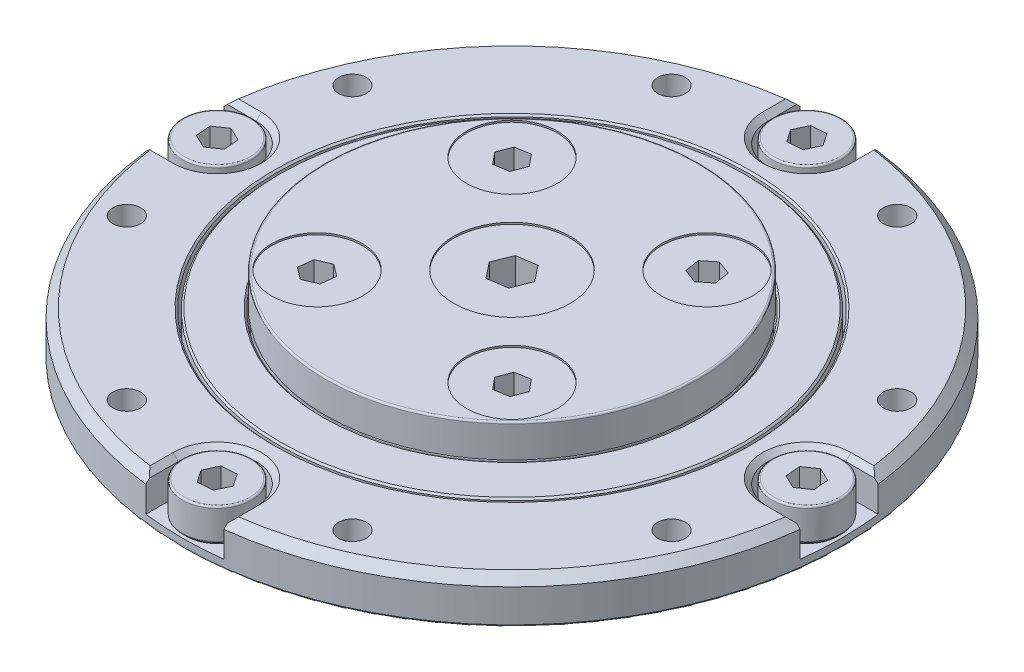
from build123d import *

# Parameters (mm, degrees)
SKETCH1_R                    = 19
BOSS_EXTRUDE1_DEPTH          = 2.5
CHAMFER1_SIZE                = 0.5
CUT_EXTRUDE1_DEPTH           = 2
CHAMFER2_SIZE                = 0.3
SKETCH3_R                    = 1.8
BOSS_EXTRUDE2_DEPTH          = 0.4
SKETCH4_R                    = 2
BOSS_EXTRUDE3_DEPTH          = 1.6
CHAMFER3_SIZE                = 0.4
FILLET1_R                    = 0.1
CUT_EXTRUDE2_DEPTH           = 1.5
CIRPATTERN1_COUNT            = 4
CHAMFER2_OF_CIRPATTERN1_SIZE = 0.3
CHAMFER3_OF_CIRPATTERN1_SIZE = 0.4
FILLET1_OF_CIRPATTERN1_R     = 0.1
CUT_EXTRUDE3_DEPTH           = 27.986107678
CUT_EXTRUDE3_DEPTH_BACK      = 27.986107678
SKETCH6_R                    = 0.5
M2_TAPPED_HOLE1_D            = 1.6
CIRPATTERN2_COUNT            = 8
SKETCH9_R                    = 13.639669348
SKETCH9_R_2                  = 13.482003981
CUT_EXTRUDE4_DEPTH           = 2.49
CHAMFER4_SIZE                = 0.1
SKETCH11_R                   = 10.823295538
SKETCH11_R_2                 = 10.667622933
CUT_EXTRUDE5_DEPTH           = 2.49
CHAMFER5_SIZE                = 0.1
SKETCH12_R                   = 10.75
BOSS_EXTRUDE4_DEPTH          = 1.9
FILLET2_R                    = 0.1
SKETCH13_R                   = 3.357648563
SKETCH13_R_2                 = 2.616913992
CUT_EXTRUDE6_DEPTH           = 0.1
CUT_EXTRUDE7_DEPTH           = 1.5
CUT_EXTRUDE8_DEPTH           = 2
FILLET3_R                    = 0.1


with BuildPart() as part:
    # Sketch1 → Boss-Extrude1 (new body)
    with BuildSketch(Plane(origin=(0, 0, 0), x_dir=(1, 0, 0), z_dir=(0, 1, 0))):
        with Locations(Location((0, 0, 0), (0, 0, 270))):
            Circle(SKETCH1_R)
    extrude(amount=BOSS_EXTRUDE1_DEPTH)

    # Chamfer1
    chamfer1_edges = [part.edges().sort_by_distance(p)[0] for p in [
        (0, 2.5, -19),
    ]]
    chamfer(chamfer1_edges, length=CHAMFER1_SIZE)

    # Sketch2 → Cut-Extrude1 (cut)
    with BuildSketch(Plane(origin=(0, 2.5, 0), x_dir=(1, 0, 0), z_dir=(0, 1, 0))):
        with BuildLine():
            Line((-2.25, 17), (-2.25, 19.25))
            Line((-2.25, 19.25), (2.25, 19.25))
            Line((2.25, 19.25), (2.25, 17))
            ThreePointArc((2.25, 17), (0, 14.75), (-2.25, 17))
        make_face()
    cut_extrude1 = extrude(amount=-CUT_EXTRUDE1_DEPTH, mode=Mode.SUBTRACT)

    # Chamfer2
    chamfer2_edges = [part.edges().sort_by_distance(p)[0] for p in [
        (2.25, 2.5, -17.681332964),
        (0, 2.5, -14.75),
        (-2.25, 2.5, -17.681332964),
    ]]
    chamfer(chamfer2_edges, length=CHAMFER2_SIZE)

    # Sketch3 → Boss-Extrude2 (add)
    with BuildSketch(Plane(origin=(0, 0.5, 0), x_dir=(1, 0, 0), z_dir=(0, 1, 0))):
        with Locations(Location((0, 17, 0), (0, 0, 270))):
            Circle(SKETCH3_R)
    boss_extrude2 = extrude(amount=BOSS_EXTRUDE2_DEPTH)

    # Sketch4 → Boss-Extrude3 (add)
    with BuildSketch(Plane(origin=(0, 0.9, 0), x_dir=(1, 0, 0), z_dir=(0, 1, 0))):
        with Locations(Location((0, 17, 0), (0, 0, 270))):
            Circle(SKETCH4_R)
    boss_extrude3 = extrude(amount=BOSS_EXTRUDE3_DEPTH)

    # Chamfer3
    # the kernel refuses this chamfer: 0.4 mm, written as the material it adds along each edge
    with BuildSketch(Plane(origin=(0, 0.9, -17), x_dir=(0, 0, 1), z_dir=(-1, 0, 0))) as chamfer3_piece_1_section:
        Polygon((1.8 + CHAMFER3_SIZE, 0), (1.8, -CHAMFER3_SIZE), (1.8, 0), align=None)
    chamfer3_piece_1 = revolve(axis=Axis((0, 0.9, -17), (0, 1, 0)), mode=Mode.PRIVATE)
    chamfer3_piece_1 = chamfer3_piece_1 & Plane(origin=(0, 0.600836468, -17), x_dir=(0, 0, 1), z_dir=(0, -1, 0)) * Cylinder(2, 9, mode=Mode.PRIVATE)
    add(chamfer3_piece_1)

    # Fillet1
    fillet1_edges = [part.edges().sort_by_distance(p)[0] for p in [
        (0, 2.5, -19),
        (0, 0.7, -19),
    ]]
    fillet(fillet1_edges, radius=FILLET1_R)

    # Sketch5 → Cut-Extrude2 (cut)
    with BuildSketch(Plane(origin=(0, 2.5, 0), x_dir=(1, 0, 0), z_dir=(0, 1, 0))):
        Polygon((-0.490661702, 17.713618312), (-0.863342437, 16.931883658), (-0.372680736, 16.218265346), (0.490661702, 16.286381688), (0.863342437, 17.068116342), (0.372680736, 17.781734654), align=None)
    cut_extrude2 = extrude(amount=-CUT_EXTRUDE2_DEPTH, mode=Mode.SUBTRACT)

    # CirPattern1: Cut-Extrude1, Boss-Extrude2, Boss-Extrude3, Cut-Extrude2 ×4 about axis
    cirpattern1_axis = Axis((0, 0, 0), (0, 1, 0))
    add([cut_extrude1.rotate(cirpattern1_axis, i * 360 / CIRPATTERN1_COUNT) for i in range(1, CIRPATTERN1_COUNT)], mode=Mode.SUBTRACT)
    add([boss_extrude2.rotate(cirpattern1_axis, i * 360 / CIRPATTERN1_COUNT) for i in range(1, CIRPATTERN1_COUNT)])
    add([boss_extrude3.rotate(cirpattern1_axis, i * 360 / CIRPATTERN1_COUNT) for i in range(1, CIRPATTERN1_COUNT)])
    add([cut_extrude2.rotate(cirpattern1_axis, i * 360 / CIRPATTERN1_COUNT) for i in range(1, CIRPATTERN1_COUNT)], mode=Mode.SUBTRACT)

    # Chamfer2 of CirPattern1
    chamfer2_of_cirpattern1_edges = [part.edges().sort_by_distance(p)[0] for p in [
        (-17.681332964, 2.5, -2.25),
        (-14.75, 2.5, 0),
        (-17.681332964, 2.5, 2.25),
        (-2.25, 2.5, 17.681332964),
        (0, 2.5, 14.75),
        (2.25, 2.5, 17.681332964),
        (17.681332964, 2.5, 2.25),
        (14.75, 2.5, 0),
        (17.681332964, 2.5, -2.25),
    ]]
    chamfer(chamfer2_of_cirpattern1_edges, length=CHAMFER2_OF_CIRPATTERN1_SIZE)

    # Chamfer3 of CirPattern1
    # the kernel refuses this chamfer: 0.4 mm, written as the material it adds along each edge
    with BuildSketch(Plane(origin=(-17, 0.9, 0), x_dir=(1, 0, 0), z_dir=(0, 0, 1))) as chamfer3_of_cirpattern1_piece_1_section:
        Polygon((1.8, -CHAMFER3_OF_CIRPATTERN1_SIZE), (1.8 + CHAMFER3_OF_CIRPATTERN1_SIZE, 0), (1.8, 0), align=None)
    chamfer3_of_cirpattern1_piece_1 = revolve(axis=Axis((-17, 0.9, 0), (0, 1, 0)), mode=Mode.PRIVATE)
    chamfer3_of_cirpattern1_piece_1 = chamfer3_of_cirpattern1_piece_1 & Plane(origin=(-17, 0.600836468, 0), x_dir=(1, 0, 0), z_dir=(0, -1, 0)) * Cylinder(2, 9, mode=Mode.PRIVATE)
    add(chamfer3_of_cirpattern1_piece_1)
    with BuildSketch(Plane(origin=(0, 0.9, 17), x_dir=(0, 0, -1), z_dir=(1, 0, 0))) as chamfer3_of_cirpattern1_piece_2_section:
        Polygon((1.8, -CHAMFER3_OF_CIRPATTERN1_SIZE), (1.8 + CHAMFER3_OF_CIRPATTERN1_SIZE, 0), (1.8, 0), align=None)
    chamfer3_of_cirpattern1_piece_2 = revolve(axis=Axis((0, 0.9, 17), (0, 1, 0)), mode=Mode.PRIVATE)
    chamfer3_of_cirpattern1_piece_2 = chamfer3_of_cirpattern1_piece_2 & Plane(origin=(0, 0.600836468, 17), x_dir=(0, 0, -1), z_dir=(0, -1, 0)) * Cylinder(2, 9, mode=Mode.PRIVATE)
    add(chamfer3_of_cirpattern1_piece_2)
    with BuildSketch(Plane(origin=(17, 0.9, 0), x_dir=(-1, 0, 0), z_dir=(0, 0, -1))) as chamfer3_of_cirpattern1_piece_3_section:
        Polygon((1.8, -CHAMFER3_OF_CIRPATTERN1_SIZE), (1.8 + CHAMFER3_OF_CIRPATTERN1_SIZE, 0), (1.8, 0), align=None)
    chamfer3_of_cirpattern1_piece_3 = revolve(axis=Axis((17, 0.9, 0), (0, 1, 0)), mode=Mode.PRIVATE)
    chamfer3_of_cirpattern1_piece_3 = chamfer3_of_cirpattern1_piece_3 & Plane(origin=(17, 0.600836468, 0), x_dir=(-1, 0, 0), z_dir=(0, -1, 0)) * Cylinder(2, 9, mode=Mode.PRIVATE)
    add(chamfer3_of_cirpattern1_piece_3)

    # Fillet1 of CirPattern1
    fillet1_of_cirpattern1_edges = [part.edges().sort_by_distance(p)[0] for p in [
        (-19, 2.5, 0),
        (-19, 0.7, 0),
        (0, 2.5, 19),
        (0, 0.7, 19),
        (19, 2.5, 0),
        (19, 0.7, 0),
    ]]
    fillet(fillet1_of_cirpattern1_edges, radius=FILLET1_OF_CIRPATTERN1_R)

    # Sketch6 → Cut-Extrude3 (cut, two sides: drawn at the far end of the back side and taken through both)
    with BuildSketch(Plane(origin=(0, 2.5, 0), x_dir=(1, 0, 0), z_dir=(0, 1, 0)).offset(-CUT_EXTRUDE3_DEPTH_BACK)):
        with Locations(Location((-6.50561835, 15.705952053, 0), (0, 0, 270))):
            Circle(SKETCH6_R)
    extrude(amount=CUT_EXTRUDE3_DEPTH + CUT_EXTRUDE3_DEPTH_BACK, mode=Mode.SUBTRACT)

    # M2 Tapped Hole1 (through all)
    with Locations(Plane(origin=(0, 2.5, 0), x_dir=(1, 0, 0), z_dir=(0, 1, 0))):
        with Locations((-6.50561835, 15.705952053)):
            m2_tapped_hole1 = Hole(M2_TAPPED_HOLE1_D / 2)

    # CirPattern2: M2 Tapped Hole1 ×8 about axis
    cirpattern2_axis = Axis((0, 0, 0), (0, 1, 0))
    for i in range(1, CIRPATTERN2_COUNT):
        add(m2_tapped_hole1.rotate(cirpattern2_axis, i * 360 / CIRPATTERN2_COUNT), mode=Mode.SUBTRACT)

    # Sketch9 → Cut-Extrude4 (cut)
    with BuildSketch(Plane(origin=(0, 2.5, 0), x_dir=(1, 0, 0), z_dir=(0, 1, 0))):
        with Locations(Location((0, 0, 0), (0, 0, 270))):
            Circle(SKETCH9_R)
        with Locations(Location((0, 0, 0), (0, 0, 270))):
            Circle(SKETCH9_R_2, mode=Mode.SUBTRACT)
    extrude(amount=-CUT_EXTRUDE4_DEPTH, mode=Mode.SUBTRACT)

    # Chamfer4
    chamfer4_edges = [part.edges().sort_by_distance(p)[0] for p in [
        (0, 2.5, -13.639669348),
        (0, 2.5, -13.482003981),
    ]]
    chamfer(chamfer4_edges, length=CHAMFER4_SIZE)

    # Sketch11 → Cut-Extrude5 (cut)
    with BuildSketch(Plane(origin=(0, 2.5, 0), x_dir=(1, 0, 0), z_dir=(0, 1, 0))):
        with Locations(Location((0, 0, 0), (0, 0, 270))):
            Circle(SKETCH11_R)
        with Locations(Location((0, 0, 0), (0, 0, 270))):
            Circle(SKETCH11_R_2, mode=Mode.SUBTRACT)
    extrude(amount=-CUT_EXTRUDE5_DEPTH, mode=Mode.SUBTRACT)

    # Chamfer5
    chamfer5_edges = [part.edges().sort_by_distance(p)[0] for p in [
        (0, 2.5, -10.823295538),
        (0, 2.5, -10.667622933),
    ]]
    chamfer(chamfer5_edges, length=CHAMFER5_SIZE)

    # Sketch12 → Boss-Extrude4 (add)
    with BuildSketch(Plane(origin=(0, 2.5, 0), x_dir=(1, 0, 0), z_dir=(0, 1, 0))):
        with Locations(Location((0, 0, 0), (0, 0, 90))):
            Circle(SKETCH12_R)
    extrude(amount=BOSS_EXTRUDE4_DEPTH)

    # Fillet2
    fillet2_edges = [part.edges().sort_by_distance(p)[0] for p in [
        (0, 2.4, -10.667622933),
        (0, 4.4, 10.75),
    ]]
    fillet(fillet2_edges, radius=FILLET2_R)

    # Sketch13 → Cut-Extrude6 (cut)
    with BuildSketch(Plane(origin=(0, 4.4, 0), x_dir=(1, 0, 0), z_dir=(0, 1, 0))):
        with Locations(Location((0, 0, 0), (0, 0, 270))):
            Circle(SKETCH13_R)
        with Locations(Location((-5.62099494, 5.62099494, 0), (0, 0, 270))):
            Circle(SKETCH13_R_2)
        with Locations(Location((5.62099494, 5.62099494, 0), (0, 0, 270))):
            Circle(SKETCH13_R_2)
        with Locations(Location((5.62099494, -5.62099494, 0), (0, 0, 270))):
            Circle(SKETCH13_R_2)
        with Locations(Location((-5.62099494, -5.62099494, 0), (0, 0, 270))):
            Circle(SKETCH13_R_2)
    extrude(amount=-CUT_EXTRUDE6_DEPTH, mode=Mode.SUBTRACT)

    # Sketch14 → Cut-Extrude7 (cut)
    with BuildSketch(Plane(origin=(0, 4.3, 0), x_dir=(1, 0, 0), z_dir=(0, 1, 0))):
        Polygon((4.947070538, 5.077096144), (5.755062913, 4.765409889), (6.428987315, 5.309308685), (6.294919342, 6.164893736), (5.486926966, 6.47657999), (4.813002564, 5.932681194), align=None)
        Polygon((-5.071271772, 4.951813022), (-4.766604815, 5.762478209), (-5.316327983, 6.431660127), (-6.170718107, 6.290176858), (-6.475385064, 5.479511671), (-5.925661897, 4.810329753), align=None)
        Polygon((-4.927107968, -6.139184935), (-4.825285754, -5.279166193), (-5.519172726, -4.760976198), (-6.314881911, -5.102804945), (-6.416704125, -5.962823687), (-5.722817154, -6.481013682), align=None)
        Polygon((6.173828098, -6.287609896), (6.474717005, -5.475534859), (5.921883847, -4.808919903), (5.068161782, -4.954379984), (4.767272874, -5.766455021), (5.320106032, -6.433069976), align=None)
    extrude(amount=-CUT_EXTRUDE7_DEPTH, mode=Mode.SUBTRACT)

    # Sketch15 → Cut-Extrude8 (cut)
    with BuildSketch(Plane(origin=(0, 4.3, 0), x_dir=(1, 0, 0), z_dir=(0, 1, 0))):
        Polygon((-0.42647204, -1.073058681), (0.716060057, -0.905864961), (1.142532097, 0.16719372), (0.42647204, 1.073058681), (-0.716060057, 0.905864961), (-1.142532097, -0.16719372), align=None)
    extrude(amount=-CUT_EXTRUDE8_DEPTH, mode=Mode.SUBTRACT)

    # Fillet3
    fillet3_edges = [part.edges().sort_by_distance(p)[0] for p in [
        (0, 0, -19),
    ]]
    fillet(fillet3_edges, radius=FILLET3_R)


solid = part.part
